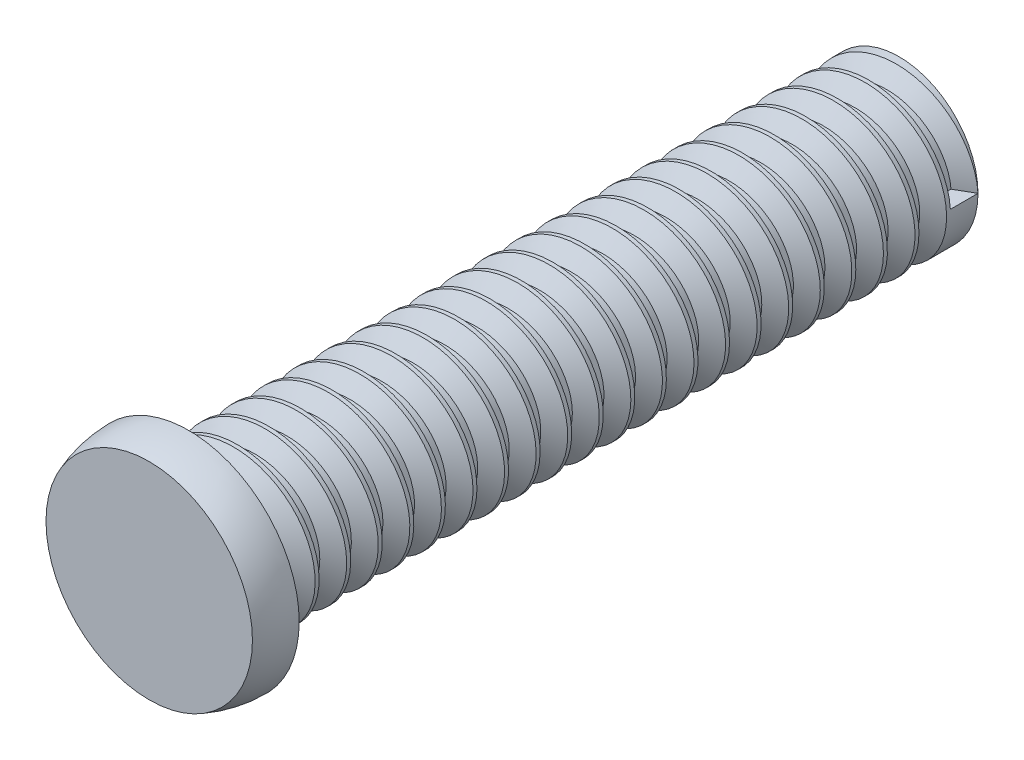
from build123d import *

# Parameters (mm, degrees)
REVOLVE_1_ANGLE     = 180
SKETCH_2_R          = 5
EXTRUDE_1_DEPTH     = 45
THREAD_2_PITCH      = 2
CUT_EXTRUDE_1_DEPTH = 56


with BuildPart() as part:
    # 草图1 → 旋转1 (revolve)
    with BuildSketch(Plane.XY):
        with BuildLine():
            ThreePointArc((7, 0), (4.949747468, 4.949747468), (0, 7))
            Line((0, 7), (0, -7))
            ThreePointArc((0, -7), (4.949747468, -4.949747468), (7, 0))
        make_face()
    revolve(axis=Axis((0, 7, 0), (0, -1, 0)), revolution_arc=REVOLVE_1_ANGLE)

    # Sketch 2 → 凸台-拉伸1 (add)
    with BuildSketch(Plane(origin=(0, 0, 0), x_dir=(-1, 0, 0), z_dir=(0, 0, -1))):
        with Locations(Location((0, 0, 0), (0, 0, 180))):
            Circle(SKETCH_2_R)
    extrude(amount=EXTRUDE_1_DEPTH)

    # 螺纹线2: the profile of Sketch 2 2 profile screwed along a right-hand helix of 22.5 turns, 10 arcs to a turn; built about Z, then put on its axis
    thread_2_z = Axis((0, 0, 0), (0, 0, 1))
    thread_2_corners = [(5.0003, 0, -0.000173205), (5.0003, 0, 1.7501732), (3.91746825, 0, 1.124999997), (3.91746825, 0, 0.624999997)]
    with BuildLine(mode=Mode.PRIVATE) as thread_2_profile:
        Line(thread_2_corners[0], thread_2_corners[1])
        Line(thread_2_corners[1], thread_2_corners[2])
        Line(thread_2_corners[2], thread_2_corners[3])
        Line(thread_2_corners[3], thread_2_corners[0])
    thread_2_cap = Face(thread_2_profile.wire())
    thread_2_turn_angles = [0, 18, 36, 54, 72, 90, 108, 126, 144, 162, 180, 198, 216, 234, 252, 270, 288, 306, 324, 342, 360]
    thread_2_turn_weights = [1, 0.9510565162951535, 1, 0.9510565162951535, 1, 0.9510565162951535, 1, 0.9510565162951535, 1, 0.9510565162951535, 1, 0.9510565162951535, 1, 0.9510565162951535, 1, 0.9510565162951535, 1, 0.9510565162951535, 1, 0.9510565162951535, 1]
    thread_2_turn_rails = [Edge.make_bspline([Vector(p[0], p[1], 0).rotate(thread_2_z, thread_2_turn_angles[k]) / thread_2_turn_weights[k] + Vector(0, 0, p[2] + THREAD_2_PITCH * thread_2_turn_angles[k] / 360) for k in range(21)], [0, 0, 0, 1, 1, 2, 2, 3, 3, 4, 4, 5, 5, 6, 6, 7, 7, 8, 8, 9, 9, 10, 10, 10], 2, thread_2_turn_weights) for p in thread_2_corners]
    thread_2_turn_sides = [Face.make_surface_from_curves(thread_2_turn_rails[p[0]], thread_2_turn_rails[p[1]]) for p in [(0, 1), (1, 2), (2, 3), (3, 0)]]
    thread_2_last_angles = [7920, 7938, 7956, 7974, 7992, 8010, 8028, 8046, 8064, 8082, 8100]
    thread_2_last_weights = [1, 0.9510565162951535, 1, 0.9510565162951535, 1, 0.9510565162951535, 1, 0.9510565162951535, 1, 0.9510565162951535, 1]
    thread_2_last_rails = [Edge.make_bspline([Vector(p[0], p[1], 0).rotate(thread_2_z, thread_2_last_angles[k]) / thread_2_last_weights[k] + Vector(0, 0, p[2] + THREAD_2_PITCH * thread_2_last_angles[k] / 360) for k in range(11)], [0, 0, 0, 1, 1, 2, 2, 3, 3, 4, 4, 5, 5, 5], 2, thread_2_last_weights) for p in thread_2_corners]
    thread_2_last_sides = [Face.make_surface_from_curves(thread_2_last_rails[p[0]], thread_2_last_rails[p[1]]) for p in [(0, 1), (1, 2), (2, 3), (3, 0)]]
    thread_2 = Plane(origin=(0, 0, -45), x_dir=(1, 0, 0), z_dir=(0, 0, 1)) * Solid(Shell([*[p.moved(Location((0, 0, THREAD_2_PITCH * i))) for i in range(22) for p in thread_2_turn_sides], *thread_2_last_sides, thread_2_cap, thread_2_cap.rotate(thread_2_z, 8100).moved(Location((0, 0, THREAD_2_PITCH * 8100 / 360)))]))
    add(thread_2, mode=Mode.SUBTRACT)

    # 草图3 → 切除-拉伸1 (cut)
    with BuildSketch(Plane(origin=(-19.217565988, -23.036604731, 0), x_dir=(0.767886824351732, -0.6405855329204777, -3.7316143757232465e-15), z_dir=(-0.6405855329204777, -0.767886824351732, -4.4731848682494575e-15))):
        Polygon((0, 2.5), (-9.961668179, 2.5), (-9.961668179, 8.494444127), (7.742400174, 8.494444127), (7.742400174, 2.5), align=None)
    extrude(amount=-CUT_EXTRUDE_1_DEPTH, mode=Mode.SUBTRACT)


solid = part.part
